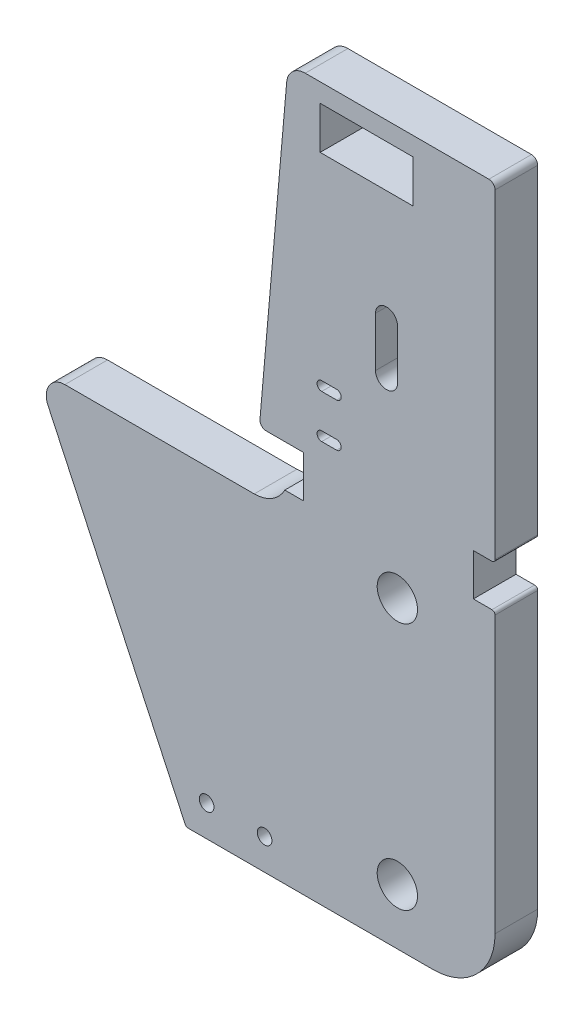
from build123d import *

# Parameters (mm, degrees)
BOSS_EXTRUDE1_DEPTH = 6.88
SKETCH2_W           = 15
SKETCH2_H           = 6.858
CUT_EXTRUDE1_DEPTH  = 137.841297579
SKETCH3_R           = 3.25
CUT_EXTRUDE2_DEPTH  = 137.841297579
SKETCH4_R           = 1.1811
CUT_EXTRUDE3_DEPTH  = 137.841297579
CUT_EXTRUDE4_DEPTH  = 137.841297579
FILLET1_R           = 10
FILLET2_R           = 3
FILLET3_R           = 0.5
FILLET4_R           = 1
FILLET5_R           = 5.5512


with BuildPart() as part:
    # Sketch1 → Boss-Extrude1 (new body)
    with BuildSketch(Plane.XY):
        Polygon((-33.3545, 0), (0, 0), (0, -53.098), (-3.5, -53.098), (-3.5, -59.858), (0, -59.858), (0, -114.858), (-49.8185, -114.858), (-74.066498224, -62.858), (-33.899973056, -62.858), (-33.899973056, -59.858), (-30.899973056, -59.858), (-30.899973056, -53.098), (-37.999973056, -53.098), align=None)
    extrude(amount=BOSS_EXTRUDE1_DEPTH)

    # Sketch2 → Cut-Extrude1 (cut, through all)
    with BuildSketch(Plane.XY.offset(6.88)):
        with Locations((-20.7, -6.429)):
            Rectangle(SKETCH2_W, SKETCH2_H)
    extrude(amount=-CUT_EXTRUDE1_DEPTH, mode=Mode.SUBTRACT)

    # Sketch3 → Cut-Extrude2 (cut, through all)
    with BuildSketch(Plane.XY.offset(6.88)):
        with Locations((-15.75, -65.858)):
            Circle(SKETCH3_R)
        with Locations((-15.75, -105.858)):
            Circle(SKETCH3_R)
    extrude(amount=-CUT_EXTRUDE2_DEPTH, mode=Mode.SUBTRACT)

    # Sketch4 → Cut-Extrude3 (cut, through all)
    with BuildSketch(Plane.XY.offset(6.88)):
        with Locations((-46.5, -109.858)):
            Circle(SKETCH4_R)
        with Locations((-37.1528, -109.858)):
            Circle(SKETCH4_R)
        with BuildLine():
            Line((-27.95, -48.608), (-25.55, -48.608))
            ThreePointArc((-25.55, -48.608), (-24.8, -49.358), (-25.55, -50.108))
            Line((-25.55, -50.108), (-27.95, -50.108))
            ThreePointArc((-27.95, -50.108), (-28.7, -49.358), (-27.95, -48.608))
        make_face()
        with BuildLine():
            Line((-27.95, -41.608), (-25.55, -41.608))
            ThreePointArc((-25.55, -41.608), (-24.8, -42.358), (-25.55, -43.108))
            Line((-25.55, -43.108), (-27.95, -43.108))
            ThreePointArc((-27.95, -43.108), (-28.7, -42.358), (-27.95, -41.608))
        make_face()
    extrude(amount=-CUT_EXTRUDE3_DEPTH, mode=Mode.SUBTRACT)

    # Sketch5 → Cut-Extrude4 (cut, through all)
    with BuildSketch(Plane.XY.offset(6.88)):
        with BuildLine():
            Line((-15.725, -27.858), (-15.725, -35.858))
            ThreePointArc((-15.725, -35.858), (-17.5, -37.633), (-19.275, -35.858))
            Line((-19.275, -35.858), (-19.275, -27.858))
            ThreePointArc((-19.275, -27.858), (-17.5, -26.083), (-15.725, -27.858))
        make_face()
    extrude(amount=-CUT_EXTRUDE4_DEPTH, mode=Mode.SUBTRACT)

    # Fillet1
    fillet1_edges = [part.edges().sort_by_distance(p)[0] for p in [
        (0, -114.858, 3.44),
    ]]
    fillet(fillet1_edges, radius=FILLET1_R)

    # Fillet2
    fillet2_edges = [part.edges().sort_by_distance(p)[0] for p in [
        (-74.066498224, -62.858, 3.44),
        (-33.3545, 0, 3.44),
    ]]
    fillet(fillet2_edges, radius=FILLET2_R)

    # Fillet3
    fillet3_edges = [part.edges().sort_by_distance(p)[0] for p in [
        (0, -53.098, 3.44),
        (0, -59.858, 3.44),
        (-49.8185, -114.858, 3.44),
    ]]
    fillet(fillet3_edges, radius=FILLET3_R)

    # Fillet4
    fillet4_edges = [part.edges().sort_by_distance(p)[0] for p in [
        (0, 0, 3.44),
        (-37.999973056, -53.098, 3.44),
    ]]
    fillet(fillet4_edges, radius=FILLET4_R)

    # Fillet5
    # the kernel refuses this fillet: 5.5512 mm, written as the material it adds along each edge
    with BuildSketch(Plane(origin=(-33.899973056, -62.858, 0), x_dir=(0, 1, 0), z_dir=(0, 0, 1))) as fillet5_piece_1:
        with BuildLine():
            CenterArc((5.5512, 4.93023326), FILLET5_R, 180, 62.640229199)
            Line((0, 4.93023326), (-0.111024, 4.93023326))
            Line((-0.111024, 4.93023326), (-0.111024, 0))
            Line((-0.111024, 0), (0, -0.111024))
            ThreePointArc((0, -0.111024), (1.5, -0.111024), (2.948976, -0.098604665))
            Line((2.948976, -0.098604665), (3, 0))
        make_face()
    extrude(amount=6.88)


solid = part.part
